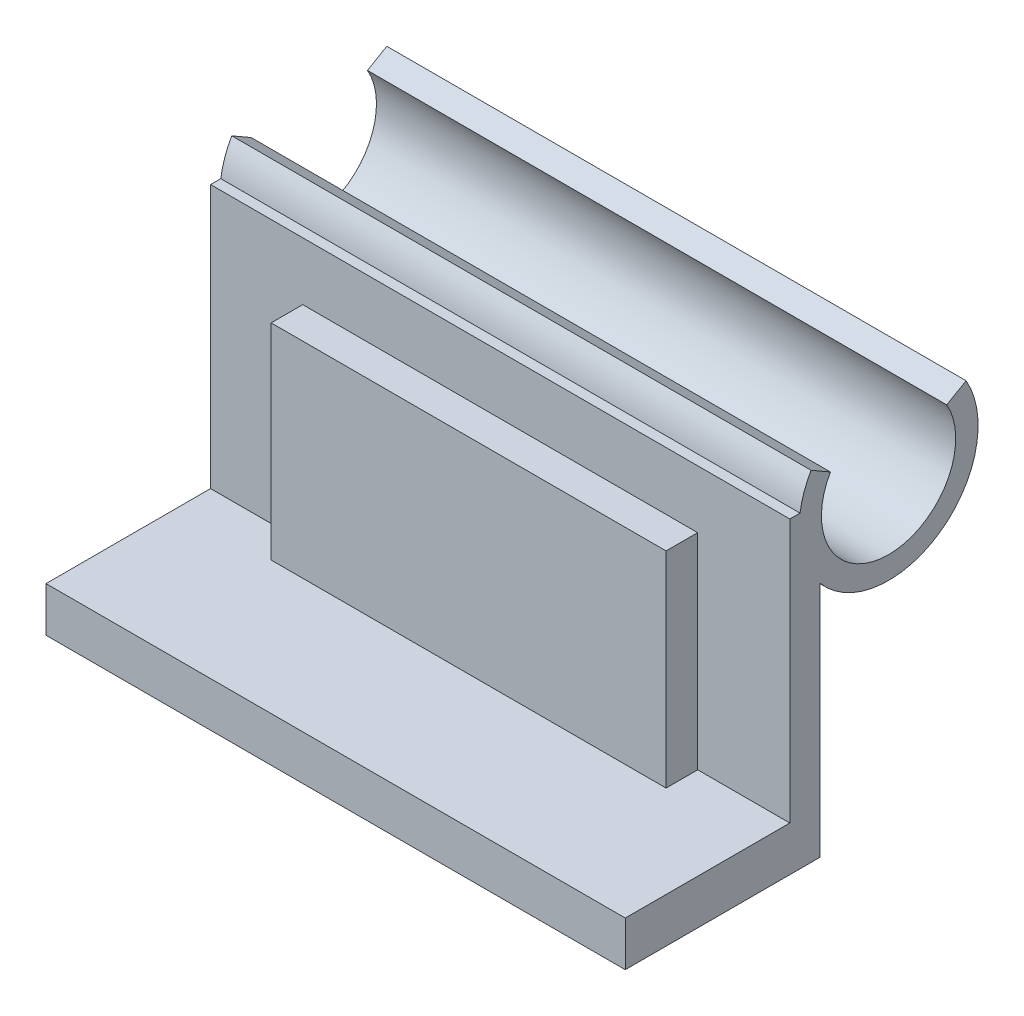
from build123d import *

# Parameters (mm, degrees)
SKETCH_1_W        = 1.15
SKETCH_1_H        = 11.7
F_01_PADDLE_DEPTH = 11
SKETCH_2_W        = 7.4
SKETCH_2_H        = 1.7
F_02_LIP_DEPTH    = 11
SKETCH_3_W        = 1.2
SKETCH_3_H        = 7.8
F_03_PAD_DEPTH    = 7.5
F_04_CLIP_DEPTH   = 11


with BuildPart() as part:
    # 草图1 → 01_PADDLE (new, symmetric)
    with BuildSketch(Plane(origin=(0, 0, 0), x_dir=(0, 0, -1), z_dir=(1, 0, 0))):
        with Locations((-3.175, -5.35)):
            Rectangle(SKETCH_1_W, SKETCH_1_H)
    extrude(amount=F_01_PADDLE_DEPTH, both=True)

    # 草图2 → 02_LIP (add, symmetric)
    with BuildSketch(Plane(origin=(0, 0, 0), x_dir=(0, 0, -1), z_dir=(1, 0, 0))):
        with Locations((-6.3, -10.35)):
            Rectangle(SKETCH_2_W, SKETCH_2_H)
    extrude(amount=F_02_LIP_DEPTH, both=True)

    # 草图3 → 03_PAD (add, symmetric)
    with BuildSketch(Plane(origin=(0, 0, 0), x_dir=(0, 0, -1), z_dir=(1, 0, 0))):
        with Locations((-4.35, -5.6)):
            Rectangle(SKETCH_3_W, SKETCH_3_H)
    extrude(amount=F_03_PAD_DEPTH, both=True)

    # 草图4 → 04_CLIP (add, symmetric)
    with BuildSketch(Plane(origin=(0, 0, 0), x_dir=(0, 0, -1), z_dir=(1, 0, 0))):
        with BuildLine():
            Line((2.944486373, 1.7), (2.20836478, 1.275))
            ThreePointArc((2.20836478, 1.275), (0, -2.55), (-2.20836478, 1.275))
            Line((-2.20836478, 1.275), (-2.944486373, 1.7))
            ThreePointArc((-2.944486373, 1.7), (0, -3.4), (2.944486373, 1.7))
        make_face()
    extrude(amount=F_04_CLIP_DEPTH, both=True)


solid = part.part
